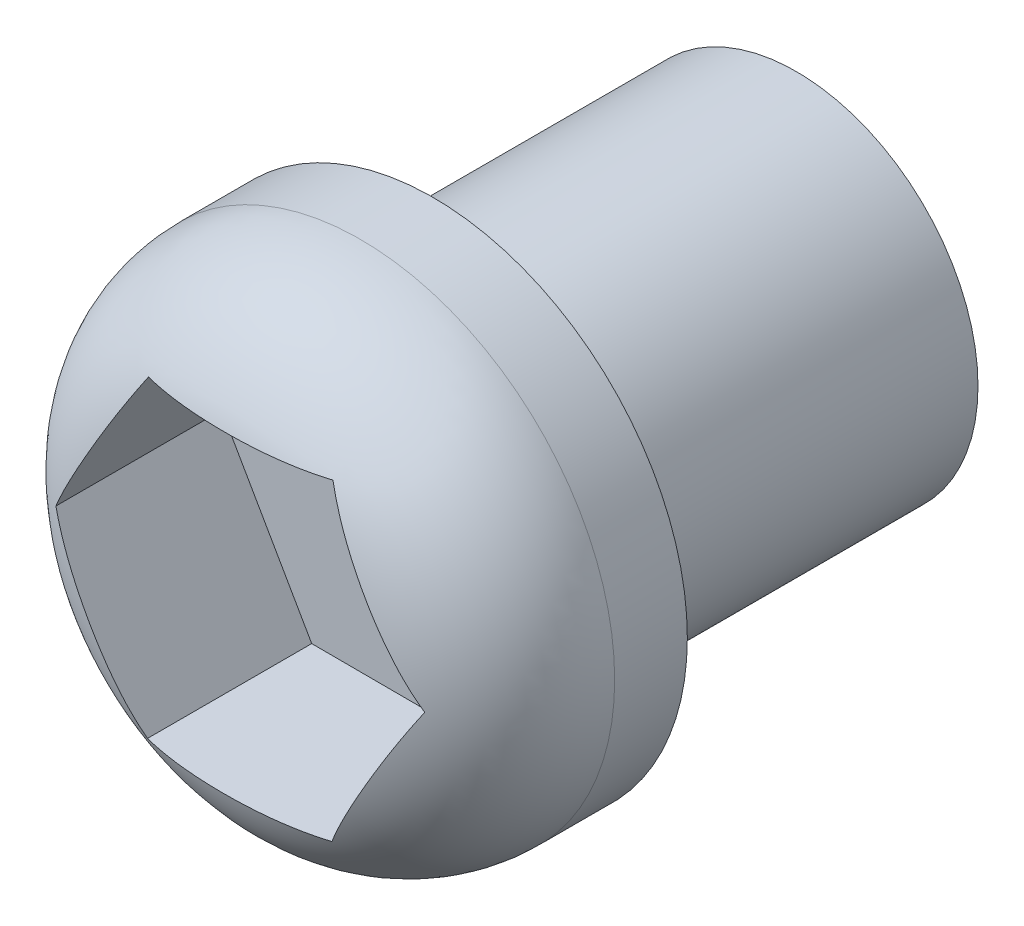
from build123d import *

# Parameters (mm, degrees)
SKETCH1_R           = 3.5
BOSS_EXTRUDE1_DEPTH = 3
SKETCH2_R           = 2.5
BOSS_EXTRUDE2_DEPTH = 5
CUT_EXTRUDE2_DEPTH  = 2.5
FILLET3_R           = 2


with BuildPart() as part:
    # Sketch1 → Boss-Extrude1 (new body)
    with BuildSketch(Plane.XY):
        with Locations((-3.184162196, -0.348949282)):
            Circle(SKETCH1_R)
    extrude(amount=BOSS_EXTRUDE1_DEPTH)

    # Sketch2 → Boss-Extrude2 (add)
    with BuildSketch(Plane(origin=(0, 0, 0), x_dir=(-1, 0, 0), z_dir=(0, 0, -1))):
        with Locations((3.184162196, -0.348949282)):
            Circle(SKETCH2_R)
    extrude(amount=BOSS_EXTRUDE2_DEPTH)

    # Sketch3 → Cut-Extrude2 (cut)
    with BuildSketch(Plane.XY.offset(3)):
        Polygon((-4.340417486, 1.812146916), (-5.592559216, -0.341272384), (-4.353714262, -2.502368582), (-1.862727578, -2.510045479), (-0.610585848, -0.356626179), (-1.849430802, 1.804470018), align=None)
    extrude(amount=-CUT_EXTRUDE2_DEPTH, mode=Mode.SUBTRACT)

    # Fillet3
    # the kernel refuses this fillet: 2 mm, written as the material it takes off along each edge
    with BuildSketch(Plane(origin=(-3.184162196, -0.348949282, 3), x_dir=(1, 0, 0), z_dir=(0, -1, 0))) as fillet3_piece_1:
        with BuildLine():
            CenterArc((3.5 - FILLET3_R, -FILLET3_R), FILLET3_R, 0, 90)
            Line((3.5 - FILLET3_R, 0), (3.5, 0))
            Line((3.5, 0), (3.5, -FILLET3_R))
        make_face()
    revolve(axis=Axis((-3.184162196, -0.348949282, 3), (0, 0, 1)), mode=Mode.SUBTRACT)


solid = part.part
